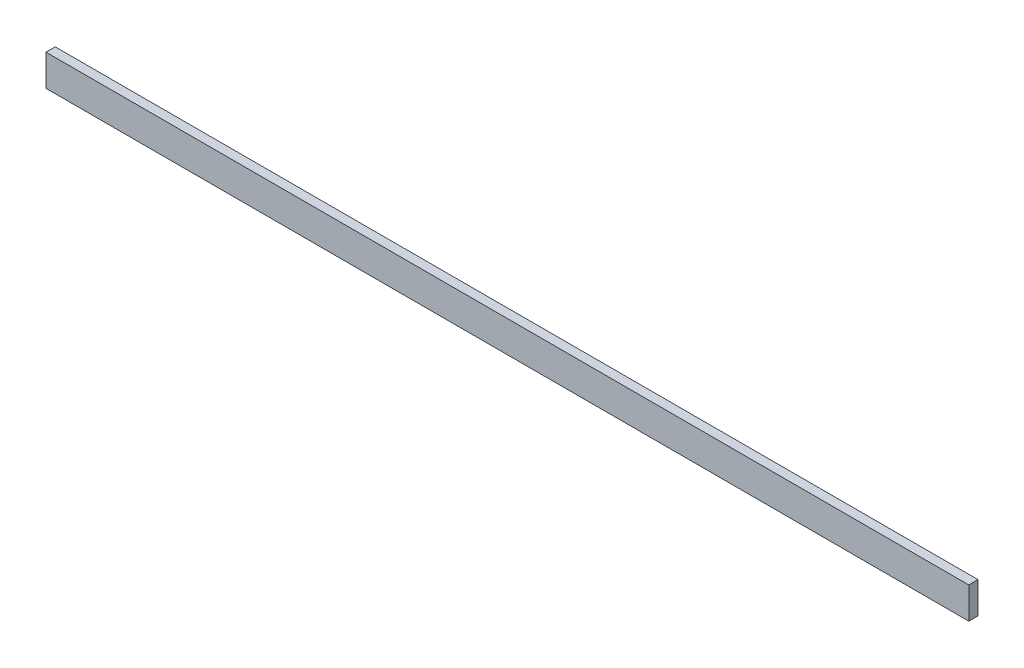
from build123d import *

# Parameters (mm, degrees)
SKETCH1_W          = 500
SKETCH1_H          = 17
BASE_FLANGE1_DEPTH = 5


# Sheet-metal steps are written as plain solids
with BuildPart() as part:
    # Sketch1 → Base-Flange1 (new body)
    with BuildSketch(Plane.XY):
        Rectangle(SKETCH1_W, SKETCH1_H)
    extrude(amount=-BASE_FLANGE1_DEPTH)


solid = part.part
